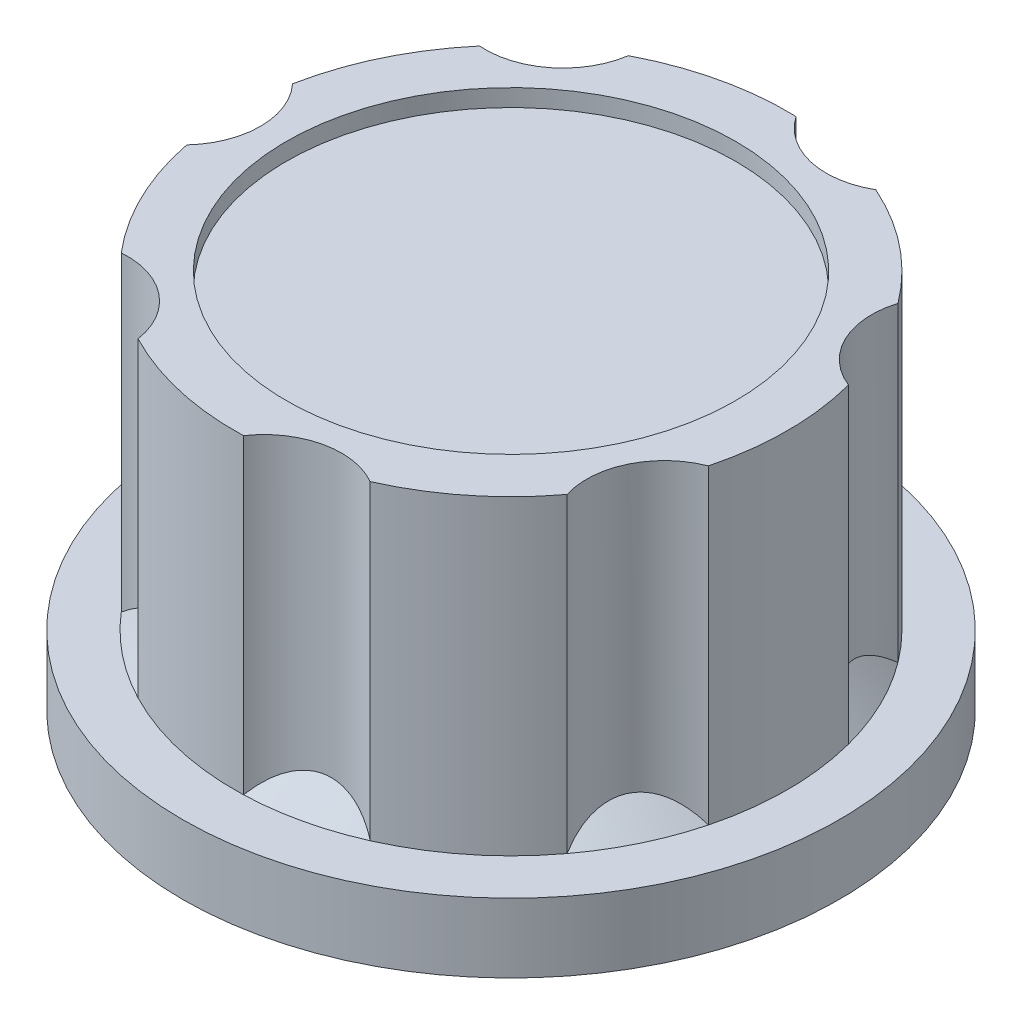
from build123d import *

# Parameters (mm, degrees)
SKETCH2_R          = 3.6
CUT_EXTRUDE1_DEPTH = 10
SKETCH3_R          = 2.25
CUT_EXTRUDE2_DEPTH = 7.5
CHAMFER1_SIZE      = 1.5


with BuildPart() as part:
    # Sketch1 → Revolve1 (revolve)
    with BuildSketch(Plane(origin=(0, 0, 0), x_dir=(0, 0, -1), z_dir=(1, 0, 0)), mode=Mode.PRIVATE) as revolve1_sk:
        Polygon((0, 0), (-9.5, 0), (-9.5, 2), (-8, 2), (-8, 11), (-6.5, 11), (-6.5, 10.5), (0, 10.5), align=None)
    revolve(revolve1_sk.sketch.rotate(Axis((0, 0, 0), (0, 1, 0)), 180), axis=Axis((0, 0, 0), (0, 1, 0)))

    # Sketch2 → Cut-Extrude1 (cut)
    with BuildSketch(Plane.XZ):
        with Locations(Location((0, 0, 0), (0, 0, 270))):
            Circle(SKETCH2_R)
    extrude(amount=-CUT_EXTRUDE1_DEPTH, mode=Mode.SUBTRACT)

    # Sketch3 → Cut-Extrude2 (cut)
    with BuildSketch(Plane(origin=(0, 11, 0), x_dir=(1, 0, 0), z_dir=(0, 1, 0))):
        with Locations((-9.5, 0)):
            Circle(SKETCH3_R)
        with Locations((-5.923153118, 7.427399083)):
            Circle(SKETCH3_R)
        with Locations((2.113948873, 9.261815166)):
            Circle(SKETCH3_R)
        with Locations((8.559204245, 4.121895522)):
            Circle(SKETCH3_R)
        with Locations((8.559204245, -4.121895522)):
            Circle(SKETCH3_R)
        with Locations((2.113948873, -9.261815166)):
            Circle(SKETCH3_R)
        with Locations((-5.923153118, -7.427399083)):
            Circle(SKETCH3_R)
    extrude(amount=-CUT_EXTRUDE2_DEPTH, mode=Mode.SUBTRACT)

    # Chamfer1
    # the kernel refuses this chamfer: 1.5 mm, written as the material it takes off along each edge
    with BuildSketch(Plane(origin=(0, 3.5, 0), x_dir=(-0.43539008787732036, 0, 0.9002418960358263), z_dir=(-0.9002418960358263, 0, -0.43539008787732036))) as chamfer1_piece_1_section:
        Polygon((8, -CHAMFER1_SIZE), (8 - CHAMFER1_SIZE, 0), (8, 0), align=None)
    chamfer1_piece_1 = revolve(axis=Axis((0, 3.5, 0), (0, 1, 0)), revolution_arc=77.334522456, mode=Mode.PRIVATE)
    chamfer1_piece_1 = split(chamfer1_piece_1, bisect_by=Plane(origin=(1.717555098, 2, 7.525103296), z_dir=(0, 1, 0)), keep=Keep.TOP, mode=Mode.PRIVATE)
    chamfer1_piece_1 = chamfer1_piece_1 & Plane(origin=(2.113948873, 2.875825312, 9.261815166), x_dir=(1, 0, 0), z_dir=(0, 1, 0)) * Cylinder(2.25, 33, mode=Mode.PRIVATE)
    add(chamfer1_piece_1, mode=Mode.SUBTRACT)
    with BuildSketch(Plane(origin=(0, 3.5, 0), x_dir=(-0.975298735779407, 0, 0.2208899635272972), z_dir=(-0.2208899635272972, 0, -0.975298735779407))) as chamfer1_piece_2_section:
        Polygon((8, -CHAMFER1_SIZE), (8 - CHAMFER1_SIZE, 0), (8, 0), align=None)
    chamfer1_piece_2 = revolve(axis=Axis((0, 3.5, 0), (0, 1, 0)), revolution_arc=77.334522456, mode=Mode.PRIVATE)
    chamfer1_piece_2 = split(chamfer1_piece_2, bisect_by=Plane(origin=(-4.812484572, 2, 6.034663839), z_dir=(0, 1, 0)), keep=Keep.TOP, mode=Mode.PRIVATE)
    chamfer1_piece_2 = chamfer1_piece_2 & Plane(origin=(-5.923153118, 2.875825413, 7.427399083), x_dir=(1, 0, 0), z_dir=(0, 1, 0)) * Cylinder(2.25, 32, mode=Mode.PRIVATE)
    add(chamfer1_piece_2, mode=Mode.SUBTRACT)
    with BuildSketch(Plane(origin=(0, 3.5, 0), x_dir=(-0.7807875431710312, 0, -0.624796616851392), z_dir=(0.624796616851392, 0, -0.7807875431710312))) as chamfer1_piece_3_section:
        Polygon((8, -CHAMFER1_SIZE), (8 - CHAMFER1_SIZE, 0), (8, 0), align=None)
    chamfer1_piece_3 = revolve(axis=Axis((0, 3.5, 0), (0, 1, 0)), revolution_arc=77.334522456, mode=Mode.PRIVATE)
    chamfer1_piece_3 = split(chamfer1_piece_3, bisect_by=Plane(origin=(-7.718624937, 2, -1.33e-07), z_dir=(0, 1, 0)), keep=Keep.TOP, mode=Mode.PRIVATE)
    chamfer1_piece_3 = chamfer1_piece_3 & Plane(origin=(-9.5, 2.875824947, 0), x_dir=(1, 0, 0), z_dir=(0, 1, 0)) * Cylinder(2.25, 32, mode=Mode.PRIVATE)
    add(chamfer1_piece_3, mode=Mode.SUBTRACT)
    with BuildSketch(Plane(origin=(0, 3.5, 0), x_dir=(0.0016725946084597224, 0, -0.9999986012126596), z_dir=(0.9999986012126596, 0, 0.0016725946084597224))) as chamfer1_piece_4_section:
        Polygon((8, -CHAMFER1_SIZE), (8 - CHAMFER1_SIZE, 0), (8, 0), align=None)
    chamfer1_piece_4 = revolve(axis=Axis((0, 3.5, 0), (0, 1, 0)), revolution_arc=77.334522456, mode=Mode.PRIVATE)
    chamfer1_piece_4 = split(chamfer1_piece_4, bisect_by=Plane(origin=(-4.81248369, 2, -6.034664462), z_dir=(0, 1, 0)), keep=Keep.TOP, mode=Mode.PRIVATE)
    chamfer1_piece_4 = chamfer1_piece_4 & Plane(origin=(-5.923153118, 2.875825391, -7.427399083), x_dir=(1, 0, 0), z_dir=(0, 1, 0)) * Cylinder(2.25, 32, mode=Mode.PRIVATE)
    add(chamfer1_piece_4, mode=Mode.SUBTRACT)
    with BuildSketch(Plane(origin=(0, 3.5, 0), x_dir=(0.782873234533069, 0, -0.6221812426067909), z_dir=(0.6221812426067909, 0, 0.782873234533069))) as chamfer1_piece_5_section:
        Polygon((8, -CHAMFER1_SIZE), (8 - CHAMFER1_SIZE, 0), (8, 0), align=None)
    chamfer1_piece_5 = revolve(axis=Axis((0, 3.5, 0), (0, 1, 0)), revolution_arc=77.334522456, mode=Mode.PRIVATE)
    chamfer1_piece_5 = split(chamfer1_piece_5, bisect_by=Plane(origin=(1.717556284, 2, -7.525103041), z_dir=(0, 1, 0)), keep=Keep.TOP, mode=Mode.PRIVATE)
    chamfer1_piece_5 = chamfer1_piece_5 & Plane(origin=(2.113948873, 2.875825447, -9.261815166), x_dir=(1, 0, 0), z_dir=(0, 1, 0)) * Cylinder(2.25, 32, mode=Mode.PRIVATE)
    add(chamfer1_piece_5, mode=Mode.SUBTRACT)
    with BuildSketch(Plane(origin=(0, 3.5, 0), x_dir=(0.9745543611505972, 0, 0.22415128186640224), z_dir=(-0.22415128186640224, 0, 0.9745543611505972))) as chamfer1_piece_6_section:
        Polygon((8, -CHAMFER1_SIZE), (8 - CHAMFER1_SIZE, 0), (8, 0), align=None)
    chamfer1_piece_6 = revolve(axis=Axis((0, 3.5, 0), (0, 1, 0)), revolution_arc=77.334522456, mode=Mode.PRIVATE)
    chamfer1_piece_6 = split(chamfer1_piece_6, bisect_by=Plane(origin=(6.9542413, 2, -3.34898542), z_dir=(0, 1, 0)), keep=Keep.TOP, mode=Mode.PRIVATE)
    chamfer1_piece_6 = chamfer1_piece_6 & Plane(origin=(8.559204245, 2.875825426, -4.121895522), x_dir=(1, 0, 0), z_dir=(0, 1, 0)) * Cylinder(2.25, 32, mode=Mode.PRIVATE)
    add(chamfer1_piece_6, mode=Mode.SUBTRACT)
    with BuildSketch(Plane(origin=(0, 3.5, 0), x_dir=(0.43237617653563165, 0, 0.9016933192413196), z_dir=(-0.9016933192413196, 0, 0.43237617653563165))) as chamfer1_piece_7_section:
        Polygon((8, -CHAMFER1_SIZE), (8 - CHAMFER1_SIZE, 0), (8, 0), align=None)
    chamfer1_piece_7 = revolve(axis=Axis((0, 3.5, 0), (0, 1, 0)), revolution_arc=77.334522456, mode=Mode.PRIVATE)
    chamfer1_piece_7 = split(chamfer1_piece_7, bisect_by=Plane(origin=(6.954240779, 2, 3.348986578), z_dir=(0, 1, 0)), keep=Keep.TOP, mode=Mode.PRIVATE)
    chamfer1_piece_7 = chamfer1_piece_7 & Plane(origin=(8.559204245, 2.875825449, 4.121895522), x_dir=(1, 0, 0), z_dir=(0, 1, 0)) * Cylinder(2.25, 32, mode=Mode.PRIVATE)
    add(chamfer1_piece_7, mode=Mode.SUBTRACT)


solid = part.part
